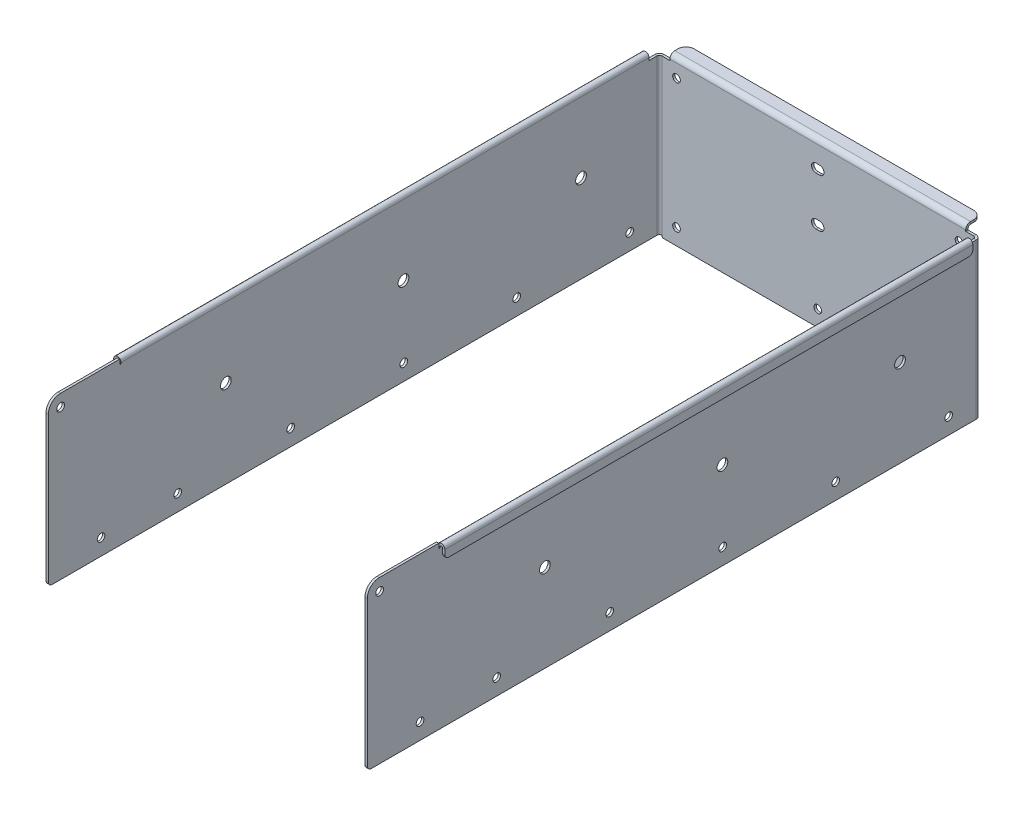
from build123d import *

# Parameters (mm, degrees)
SKETCH1_W                                 = 124.3076
SKETCH1_H                                 = 0.91186
BASE_FLANGE1_DEPTH                        = 63.5
EDGE_FLANGE2_STRIP_W                      = 5.59816
EDGE_FLANGE2_STRIP_H                      = 0.91186
EDGE_FLANGE2_STRIP_CUT_DEPTH              = 63.5
EDGE_FLANGE2_DEPTH                        = 63.5
EDGE_FLANGE3_STRIP_W                      = 5.60324
EDGE_FLANGE3_STRIP_H                      = 0.91186
EDGE_FLANGE3_STRIP_CUT_DEPTH              = 63.5
EDGE_FLANGE3_DEPTH                        = 63.5
HEM1_START                                = 3.63347
HEM1_DEPTH                                = 208.6356
HEM1_2_DEPTH                              = 0.45593
HEM1_START_2                              = 211.81314
HEM1_3_DEPTH                              = 0.45593
HEM1_START_3                              = 4.0894
HEM1_4_DEPTH                              = 207.72374
HEM2_START                                = 3.63093
HEM2_DEPTH                                = 208.63814
HEM2_2_DEPTH                              = 0.45593
HEM2_START_2                              = 211.81314
HEM2_3_DEPTH                              = 0.45593
HEM2_START_3                              = 4.08686
HEM2_4_DEPTH                              = 207.72628
EDGE_FLANGE4_STRIP_W                      = 5.67944
EDGE_FLANGE4_STRIP_H                      = 0.91186
EDGE_FLANGE4_STRIP_CUT_DEPTH              = 116.38534
EDGE_FLANGE4_RELIEF_W                     = 6.13537
EDGE_FLANGE4_RELIEF_H                     = 0.45593
EDGE_FLANGE4_RELIEF_CUT_DEPTH             = 0.91186
EDGE_FLANGE4_DEPTH                        = 116.38534
M3_START                                  = -0.91186
M3_CLEARANCE_SLOT1_DEPTH                  = 0.91186
F_1_8_0_125_DIAMETER_HOLE1_D              = 3.048
F_3_0MM_DOWEL_HOLE1_D                     = 3
FILLET2_R                                 = 3.175
FILLET3_R                                 = 4.7625
FILLET5_R                                 = 1.5875
SKETCH92_W                                = 122.73534
SKETCH92_H                                = 0.91186
BOSS_EXTRUDE1_DEPTH                       = 0.762
FILLET6_R                                 = 0.762
FILLET7_R                                 = 1.5875
HOLE_FOR_M3_FLUSH_HEAD_STUDS_FH_FHS_FHA_D = 3
HOLE_FOR_M2_5_TS_STANDOFFS_TSO_TSOS_TSO_D = 4.22
SKETCH103_W                               = 5.17525
SKETCH103_H                               = 5.17525
CUT_EXTRUDE4_DEPTH                        = 2.38252
AIR_FITTING_RELIEF_REACH                  = 259.873
SKETCH106_R                               = 5.159375


# Read off the part's stored shape, not the designer's step: Hem1, Hem2, M3 Clearance Slot1
# Sheet-metal steps are written as plain solids
with BuildPart() as part:
    # Sketch1 → Base-Flange1 (new body)
    with BuildSketch(Plane(origin=(0, 0, 0), x_dir=(1, 0, 0), z_dir=(0, 1, 0))):
        with Locations((0, 0.45593)):
            Rectangle(SKETCH1_W, SKETCH1_H)
    extrude(amount=BASE_FLANGE1_DEPTH)

    # Edge-Flange2 strip (across the edge) → Edge-Flange2 strip cut (cut)
    with BuildSketch(Plane(origin=(62.2808, 0, 0), x_dir=(-1, 0, 0), z_dir=(0, 1, 0))):
        with Locations((-1.88722, -0.45593)):
            Rectangle(EDGE_FLANGE2_STRIP_W, EDGE_FLANGE2_STRIP_H)
    extrude(amount=EDGE_FLANGE2_STRIP_CUT_DEPTH, mode=Mode.SUBTRACT)

    # Edge-Flange2 section (across the edge) → Edge-Flange2 (add)
    with BuildSketch(Plane(origin=(62.2808, 0, 0), x_dir=(-1, 0, 0), z_dir=(0, 1, 0))):
        with BuildLine():
            Line((-0.91186, 0.91186), (-0.91186, 240.38814))
            Line((-0.91186, 240.38814), (0, 240.38814))
            Line((0, 240.38814), (0, 0.91186))
            ThreePointArc((0, 0.91186), (0.267077611, 0.267077611), (0.91186, 0))
            Line((0.91186, 0), (0.91186, -0.91186))
            ThreePointArc((0.91186, -0.91186), (-0.377704779, -0.377704779), (-0.91186, 0.91186))
        make_face()
    extrude(amount=EDGE_FLANGE2_DEPTH)

    # Edge-Flange3 strip (across the edge) → Edge-Flange3 strip cut (cut)
    with BuildSketch(Plane(origin=(-62.2808, 63.5, 0), x_dir=(1, 0, 0), z_dir=(0, -1, 0))):
        with Locations((-1.88722, -0.45593)):
            Rectangle(EDGE_FLANGE3_STRIP_W, EDGE_FLANGE3_STRIP_H)
    extrude(amount=EDGE_FLANGE3_STRIP_CUT_DEPTH, mode=Mode.SUBTRACT)

    # Edge-Flange3 section (across the edge) → Edge-Flange3 (add)
    with BuildSketch(Plane(origin=(-62.2808, 63.5, 0), x_dir=(1, 0, 0), z_dir=(0, -1, 0))):
        with BuildLine():
            Line((-0.91186, 0.9144), (-0.91186, 240.38814))
            Line((-0.91186, 240.38814), (0, 240.38814))
            Line((0, 240.38814), (0, 0.9144))
            ThreePointArc((0, 0.9144), (0.267821559, 0.267821559), (0.9144, 0))
            Line((0.9144, 0), (0.9144, -0.91186))
            ThreePointArc((0.9144, -0.91186), (-0.37696083, -0.37696083), (-0.91186, 0.9144))
        make_face()
    extrude(amount=EDGE_FLANGE3_DEPTH)

    # Hem1 outline → Hem1 (cut)
    with BuildSketch(Plane.XY.offset(HEM1_START)):
        with BuildLine():
            ThreePointArc((-63.19266, 63.406012701), (-62.530768702, 62.884724843), (-62.2808, 62.08014))
            Line((-62.2808, 62.08014), (-62.2808, 63.5))
            Line((-62.2808, 63.5), (-63.19266, 63.5))
            Line((-63.19266, 63.5), (-63.19266, 63.406012701))
        make_face()
    extrude(amount=HEM1_DEPTH, mode=Mode.SUBTRACT)

    # Hem1 2 outline → Hem1 2 (cut)
    with BuildSketch(Plane.XY.offset(HEM1_START)):
        with BuildLine():
            Line((-63.19266, 61.62421), (-62.2808, 61.62421))
            Line((-62.2808, 61.62421), (-62.2808, 62.08014))
            ThreePointArc((-62.2808, 62.08014), (-62.530768702, 62.884724843), (-63.19266, 63.406012701))
            Line((-63.19266, 63.406012701), (-63.19266, 61.62421))
        make_face()
    extrude(amount=HEM1_2_DEPTH, mode=Mode.SUBTRACT)

    # Hem1 3 outline → Hem1 3 (cut)
    with BuildSketch(Plane.XY.offset(HEM1_START_2)):
        with BuildLine():
            Line((-63.19266, 61.62421), (-62.2808, 61.62421))
            Line((-62.2808, 61.62421), (-62.2808, 62.08014))
            ThreePointArc((-62.2808, 62.08014), (-62.530768702, 62.884724843), (-63.19266, 63.406012701))
            Line((-63.19266, 63.406012701), (-63.19266, 61.62421))
        make_face()
    extrude(amount=HEM1_3_DEPTH, mode=Mode.SUBTRACT)

    # Hem1 4 outline → Hem1 4 (add)
    with BuildSketch(Plane.XY.offset(HEM1_START_3)):
        with BuildLine():
            ThreePointArc((-64.20866, 62.08014), (-63.70066, 62.58814), (-63.19266, 62.08014))
            Line((-63.19266, 62.08014), (-63.19266, 63.406012701))
            ThreePointArc((-63.19266, 63.406012701), (-64.505244843, 63.250031298), (-65.12052, 62.08014))
            Line((-65.12052, 62.08014), (-65.12052, 58.7375))
            Line((-65.12052, 58.7375), (-64.20866, 58.7375))
            Line((-64.20866, 58.7375), (-64.20866, 62.08014))
        make_face()
    extrude(amount=HEM1_4_DEPTH)

    # Hem2 outline → Hem2 (cut)
    with BuildSketch(Plane.XY.offset(HEM2_START)):
        with BuildLine():
            Line((62.2808, 63.5), (62.2808, 62.08014))
            ThreePointArc((62.2808, 62.08014), (62.530768702, 62.884724843), (63.19266, 63.406012701))
            Line((63.19266, 63.406012701), (63.19266, 63.5))
            Line((63.19266, 63.5), (62.2808, 63.5))
        make_face()
    extrude(amount=HEM2_DEPTH, mode=Mode.SUBTRACT)

    # Hem2 2 outline → Hem2 2 (cut)
    with BuildSketch(Plane.XY.offset(HEM2_START)):
        with BuildLine():
            Line((62.2808, 61.62421), (63.19266, 61.62421))
            Line((63.19266, 61.62421), (63.19266, 63.406012701))
            ThreePointArc((63.19266, 63.406012701), (62.530768702, 62.884724843), (62.2808, 62.08014))
            Line((62.2808, 62.08014), (62.2808, 61.62421))
        make_face()
    extrude(amount=HEM2_2_DEPTH, mode=Mode.SUBTRACT)

    # Hem2 3 outline → Hem2 3 (cut)
    with BuildSketch(Plane.XY.offset(HEM2_START_2)):
        with BuildLine():
            Line((62.2808, 61.62421), (63.19266, 61.62421))
            Line((63.19266, 61.62421), (63.19266, 63.406012701))
            ThreePointArc((63.19266, 63.406012701), (62.530768702, 62.884724843), (62.2808, 62.08014))
            Line((62.2808, 62.08014), (62.2808, 61.62421))
        make_face()
    extrude(amount=HEM2_3_DEPTH, mode=Mode.SUBTRACT)

    # Hem2 4 outline → Hem2 4 (add)
    with BuildSketch(Plane.XY.offset(HEM2_START_3)):
        with BuildLine():
            Line((63.19266, 63.406012701), (63.19266, 62.08014))
            ThreePointArc((63.19266, 62.08014), (63.70066, 62.58814), (64.20866, 62.08014))
            Line((64.20866, 62.08014), (64.20866, 58.7375))
            Line((64.20866, 58.7375), (65.12052, 58.7375))
            Line((65.12052, 58.7375), (65.12052, 62.08014))
            ThreePointArc((65.12052, 62.08014), (64.505244843, 63.250031298), (63.19266, 63.406012701))
        make_face()
    extrude(amount=HEM2_4_DEPTH)

    # Edge-Flange4 strip (across the edge) → Edge-Flange4 strip cut (cut)
    with BuildSketch(Plane(origin=(-58.1914, 63.5, -0.91186), x_dir=(0, -1, 0), z_dir=(1, 0, 0))):
        with Locations((-0.91186, -0.45593)):
            Rectangle(EDGE_FLANGE4_STRIP_W, EDGE_FLANGE4_STRIP_H)
    extrude(amount=EDGE_FLANGE4_STRIP_CUT_DEPTH, mode=Mode.SUBTRACT)

    # Edge-Flange4 relief (on the sheet) → Edge-Flange4 relief cut (cut)
    with BuildSketch(Plane(origin=(-58.1914, 61.57214, -0.91186), x_dir=(0, -1, 0), z_dir=(0, 0, -1))):
        with Locations((-2.611755, 0.227965)):
            Rectangle(EDGE_FLANGE4_RELIEF_W, EDGE_FLANGE4_RELIEF_H)
        with Locations((-2.611755, -116.613305)):
            Rectangle(EDGE_FLANGE4_RELIEF_W, EDGE_FLANGE4_RELIEF_H)
    extrude(amount=-EDGE_FLANGE4_RELIEF_CUT_DEPTH, mode=Mode.SUBTRACT)

    # Edge-Flange4 section (across the edge) → Edge-Flange4 (add)
    with BuildSketch(Plane(origin=(-58.1914, 63.5, -0.91186), x_dir=(0, -1, 0), z_dir=(1, 0, 0))):
        with BuildLine():
            Line((0, 1.016), (0, 5.43814))
            Line((0, 5.43814), (0.91186, 5.43814))
            Line((0.91186, 5.43814), (0.91186, 1.016))
            ThreePointArc((0.91186, 1.016), (1.20943951, 0.29757951), (1.92786, 0))
            Line((1.92786, 0), (1.92786, -0.91186))
            ThreePointArc((1.92786, -0.91186), (0.564657121, -0.347202879), (0, 1.016))
        make_face()
    extrude(amount=EDGE_FLANGE4_DEPTH)

    # M3 Clearance Slot1 outline → M3 Clearance Slot1 (cut)
    with BuildSketch(Plane.XY.offset(M3_START)):
        with BuildLine():
            ThreePointArc((0.744874968, 32.463), (2.444874968, 34.163), (0.744874968, 35.863))
            Line((0.744874968, 35.863), (-0.744874968, 35.863))
            ThreePointArc((-0.744874968, 35.863), (-2.444874968, 34.163), (-0.744874968, 32.463))
            Line((-0.744874968, 32.463), (0.744874968, 32.463))
        make_face()
        with BuildLine():
            ThreePointArc((0.744874968, 51.513), (2.444874968, 53.213), (0.744874968, 54.913))
            Line((0.744874968, 54.913), (-0.744874968, 54.913))
            ThreePointArc((-0.744874968, 54.913), (-2.444874968, 53.213), (-0.744874968, 51.513))
            Line((-0.744874968, 51.513), (0.744874968, 51.513))
        make_face()
    extrude(amount=M3_CLEARANCE_SLOT1_DEPTH, mode=Mode.SUBTRACT)

    # 1/8 (0.125) Diameter Hole1 (through all)
    with Locations(Plane(origin=(63.19266, 0, 0), x_dir=(0, 0, -1), z_dir=(1, 0, 0))):
        with Locations((-235.53674, 58.7375)):
            Hole(F_1_8_0_125_DIAMETER_HOLE1_D / 2)

    # Ø3.0mm Dowel Hole1 (through all)
    with Locations(Plane(origin=(63.19266, 0, 0), x_dir=(0, 0, -1), z_dir=(1, 0, 0))):
        with Locations((-189.484, 6.35), (-100.584, 6.35), (-11.684, 6.35), (-145.034, 6.35), (-56.134, 6.35), (-219.6465, 6.35)):
            Hole(F_3_0MM_DOWEL_HOLE1_D / 2)

    # Fillet2
    fillet2_edges = [part.edges().sort_by_distance(p)[0] for p in [
        (-58.1914, 63.04407, -6.35),
        (58.19394, 63.04407, -6.35),
    ]]
    fillet(fillet2_edges, radius=FILLET2_R)

    # Fillet3
    fillet3_edges = [part.edges().sort_by_distance(p)[0] for p in [
        (62.73673, 63.5, 240.38814),
        (-62.73673, 63.5, 240.38814),
    ]]
    fillet(fillet3_edges, radius=FILLET3_R)

    # Fillet5
    fillet5_edges = [part.edges().sort_by_distance(p)[0] for p in [
        (62.73673, 0, 240.38814),
        (-62.73673, 0, 240.38814),
    ]]
    fillet(fillet5_edges, radius=FILLET5_R)

    # Sketch92 → Boss-Extrude1 (add)
    with BuildSketch(Plane.XZ):
        with Locations((0.00127, -0.45593)):
            Rectangle(SKETCH92_W, SKETCH92_H)
    extrude(amount=BOSS_EXTRUDE1_DEPTH)

    # Fillet6
    fillet6_edges = [part.edges().sort_by_distance(p)[0] for p in [
        (-61.3664, -0.762, -0.45593),
        (61.36894, -0.762, -0.45593),
    ]]
    fillet(fillet6_edges, radius=FILLET6_R - 0.0001)  # a hair under: the kernel refuses the full size

    # Fillet7
    fillet7_edges = [part.edges().sort_by_distance(p)[0] for p in [
        (-64.66459, 58.7375, 4.0894),
        (-64.66459, 58.7375, 211.81314),
        (64.66459, 58.7375, 211.81314),
        (64.66459, 58.7375, 4.08686),
    ]]
    fillet(fillet7_edges, radius=FILLET7_R)

    # Hole for M3 Flush head Studs (FH,FHS,FHA,FH4)1 (through all)
    with Locations(Plane(origin=(0, 0, -0.91186), x_dir=(-1, 0, 0), z_dir=(0, 0, -1))):
        with Locations((-55.5625, 56.35625), (-55.5625, 5.55625), (0, 5.55625), (55.5625, 56.35625), (55.5625, 5.55625)):
            Hole(HOLE_FOR_M3_FLUSH_HEAD_STUDS_FH_FHS_FHA_D / 2)

    # Hole for M2.5 TS Standoffs (TSO,TSOS,TSOA,TSO4)1 (through all)
    with Locations(Plane(origin=(63.19266, 0, 0), x_dir=(0, 0, -1), z_dir=(1, 0, 0))):
        with Locations((-170.53814, 34.432875), (-100.68814, 34.432875), (-30.83814, 34.432875)):
            Hole(HOLE_FOR_M2_5_TS_STANDOFFS_TSO_TSOS_TSO_D / 2)

    # Sketch103 → Cut-Extrude4 (cut)
    with BuildSketch(Plane(origin=(0, 63.5, 0), x_dir=(1, 0, 0), z_dir=(0, 1, 0))):
        with Locations((61.035565, -1.473835)):
            Rectangle(SKETCH103_W, SKETCH103_H)
    cut_extrude4 = extrude(amount=-CUT_EXTRUDE4_DEPTH, mode=Mode.SUBTRACT)

    # Mirror1: Cut-Extrude4 across plane
    add(cut_extrude4.mirror(Plane(origin=(0, 0, 0), x_dir=(0, 0, 1), z_dir=(1, 0, 0))), mode=Mode.SUBTRACT)

    # Sketch106 → air fitting relief (cut, up to next)
    with BuildSketch(Plane(origin=(0, 0, -0.91186), x_dir=(-1, 0, 0), z_dir=(0, 0, -1)), mode=Mode.PRIVATE) as air_fitting_relief_sk1:
        with Locations((-41.275, 26.42616)):
            Circle(SKETCH106_R)
    air_fitting_relief_tool1 = extrude(air_fitting_relief_sk1.sketch, amount=-AIR_FITTING_RELIEF_REACH, mode=Mode.PRIVATE) & part.part
    add(air_fitting_relief_tool1.solids().sort_by_distance((41.275, 26.42616, -0.91186))[0], mode=Mode.SUBTRACT)


solid = part.part
